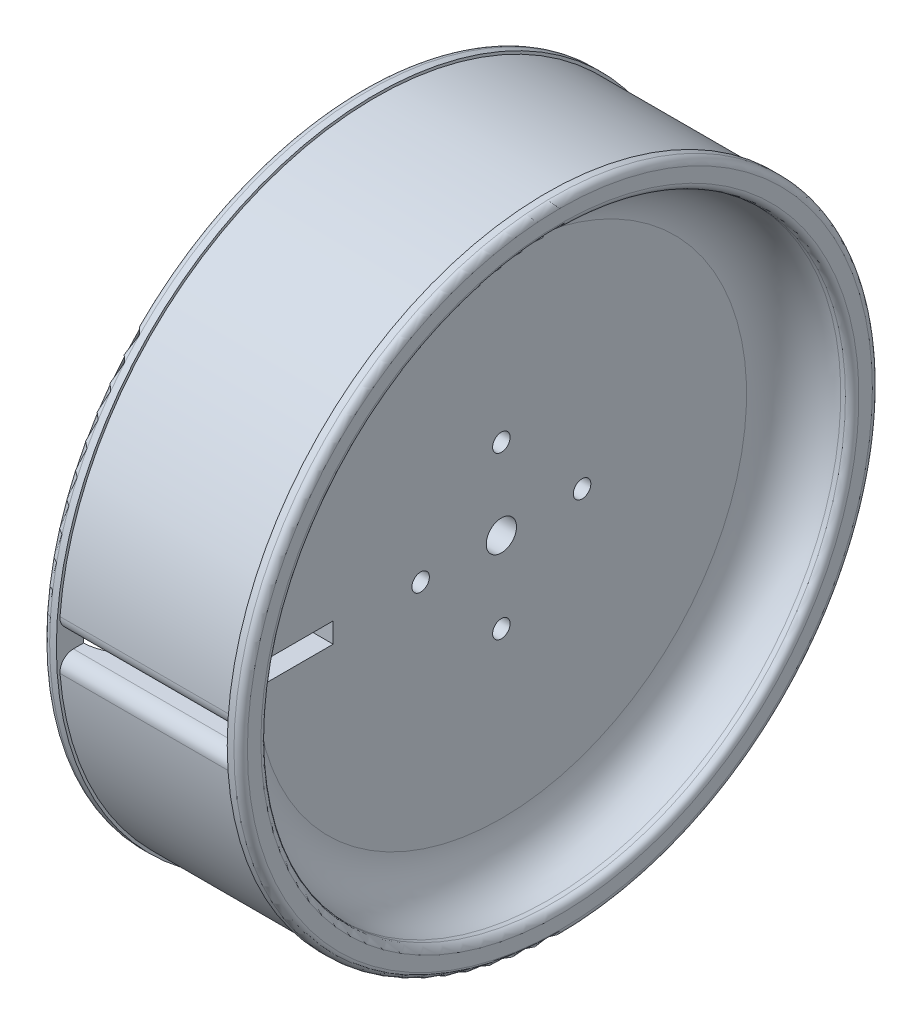
from build123d import *

# Parameters (mm, degrees)
CUT_EXTRUDE1_REACH = 72.225
SKETCH3_R          = 2.25
SKETCH3_R_2        = 1.3
CUT_EXTRUDE2_START = 25
SKETCH6_W          = 25.4
SKETCH6_H          = 3
CUT_EXTRUDE2_DEPTH = 44.695669441
FILLET1_R          = 1
FILLET2_START      = -14
FILLET2_2_DEPTH    = 28
FILLET3_R          = 2


with BuildPart() as part:
    # Sketch2 → Revolve1 (revolve)
    with BuildSketch(Plane(origin=(0, 0, 0), x_dir=(1, 0, 0), z_dir=(0, 1, 0)), mode=Mode.PRIVATE) as revolve1_sk:
        Polygon((-6, 0), (6, 0), (6, 43.45), (14.7, 43.45), (14.7, 47.45), (12.7, 47.45), (12.7, 47.05), (-12.7, 47.05), (-12.7, 47.45), (-14.7, 47.45), (-14.7, 43.45), (-6, 43.45), align=None)
    revolve(revolve1_sk.sketch.rotate(Axis((-6, 0, 0), (1, 0, 0)), 180), axis=Axis((-6, 0, 0), (1, 0, 0)))

    # Sketch3 → Cut-Extrude1 (cut, up to next)
    with BuildSketch(Plane(origin=(6, 0, 0), x_dir=(0, 0, -1), z_dir=(1, 0, 0)), mode=Mode.PRIVATE) as cut_extrude1_sk1:
        Circle(SKETCH3_R)
    cut_extrude1_tool1 = extrude(cut_extrude1_sk1.sketch, amount=-CUT_EXTRUDE1_REACH, mode=Mode.PRIVATE) & part.part
    # Sketch3 → Cut-Extrude1 (cut, up to next)
    with BuildSketch(Plane(origin=(6, 0, 0), x_dir=(0, 0, -1), z_dir=(1, 0, 0)), mode=Mode.PRIVATE) as cut_extrude1_sk2:
        with Locations((0, 12)):
            Circle(SKETCH3_R_2)
    cut_extrude1_tool2 = extrude(cut_extrude1_sk2.sketch, amount=-CUT_EXTRUDE1_REACH, mode=Mode.PRIVATE) & part.part
    # Sketch3 → Cut-Extrude1 (cut, up to next)
    with BuildSketch(Plane(origin=(6, 0, 0), x_dir=(0, 0, -1), z_dir=(1, 0, 0)), mode=Mode.PRIVATE) as cut_extrude1_sk3:
        with Locations((-12, 0)):
            Circle(SKETCH3_R_2)
    cut_extrude1_tool3 = extrude(cut_extrude1_sk3.sketch, amount=-CUT_EXTRUDE1_REACH, mode=Mode.PRIVATE) & part.part
    # Sketch3 → Cut-Extrude1 (cut, up to next)
    with BuildSketch(Plane(origin=(6, 0, 0), x_dir=(0, 0, -1), z_dir=(1, 0, 0)), mode=Mode.PRIVATE) as cut_extrude1_sk4:
        with Locations((0, -12)):
            Circle(SKETCH3_R_2)
    cut_extrude1_tool4 = extrude(cut_extrude1_sk4.sketch, amount=-CUT_EXTRUDE1_REACH, mode=Mode.PRIVATE) & part.part
    # Sketch3 → Cut-Extrude1 (cut, up to next)
    with BuildSketch(Plane(origin=(6, 0, 0), x_dir=(0, 0, -1), z_dir=(1, 0, 0)), mode=Mode.PRIVATE) as cut_extrude1_sk5:
        with Locations((12, 0)):
            Circle(SKETCH3_R_2)
    cut_extrude1_tool5 = extrude(cut_extrude1_sk5.sketch, amount=-CUT_EXTRUDE1_REACH, mode=Mode.PRIVATE) & part.part
    add(cut_extrude1_tool1.solids().sort_by_distance((6, 0, 0))[0], mode=Mode.SUBTRACT)
    add(cut_extrude1_tool2.solids().sort_by_distance((6, 12, 0))[0], mode=Mode.SUBTRACT)
    add(cut_extrude1_tool3.solids().sort_by_distance((6, 0, 12))[0], mode=Mode.SUBTRACT)
    add(cut_extrude1_tool4.solids().sort_by_distance((6, -12, 0))[0], mode=Mode.SUBTRACT)
    add(cut_extrude1_tool5.solids().sort_by_distance((6, 0, -12))[0], mode=Mode.SUBTRACT)

    # Sketch6 → Cut-Extrude2 (cut, through all)
    with BuildSketch(Plane.XY.offset(CUT_EXTRUDE2_START)):
        Rectangle(SKETCH6_W, SKETCH6_H)
    extrude(amount=CUT_EXTRUDE2_DEPTH, mode=Mode.SUBTRACT)

    # Fillet1
    fillet1_edges = [part.edges().sort_by_distance(p)[0] for p in [
        (14.7, 0, -47.45),
        (-14.7, 0, -47.45),
        (-14.7, 0, -43.45),
        (14.7, 0, -43.45),
    ]]
    fillet(fillet1_edges, radius=FILLET1_R)

    # Fillet2: read off the stored shape, not the designer's step
    # Fillet2 outline → Fillet2 (revolve)
    with BuildSketch(Plane.YX):
        with BuildLine():
            ThreePointArc((36.45, -6), (41.399747468, -8.050252532), (43.45, -13))
            Line((43.45, -13), (43.45, -6))
            Line((43.45, -6), (36.45, -6))
        make_face()
        with BuildLine():
            ThreePointArc((43.45, 13), (41.399747468, 8.050252532), (36.45, 6))
            Line((36.45, 6), (43.45, 6))
            Line((43.45, 6), (43.45, 13))
        make_face()
    revolve(axis=Axis((0, 0, 0), (1, 0, 0)))

    # Fillet2 2 outline → Fillet2 2 (cut)
    with BuildSketch(Plane.YZ.offset(FILLET2_START)):
        with BuildLine():
            ThreePointArc((-1.5, 36.419122724), (0, 36.45), (1.5, 36.419122724))
            Line((1.5, 36.419122724), (1.5, 43.424100451))
            ThreePointArc((1.5, 43.424100451), (0, 43.45), (-1.5, 43.424100451))
            Line((-1.5, 43.424100451), (-1.5, 36.419122724))
        make_face()
    extrude(amount=FILLET2_2_DEPTH, mode=Mode.SUBTRACT)

    # Fillet3
    fillet3_edges = [part.edges().sort_by_distance(p)[0] for p in [
        (0, 1.5, 47.026083188),
        (0, -1.5, 47.026083188),
    ]]
    fillet(fillet3_edges, radius=FILLET3_R)


solid = part.part
